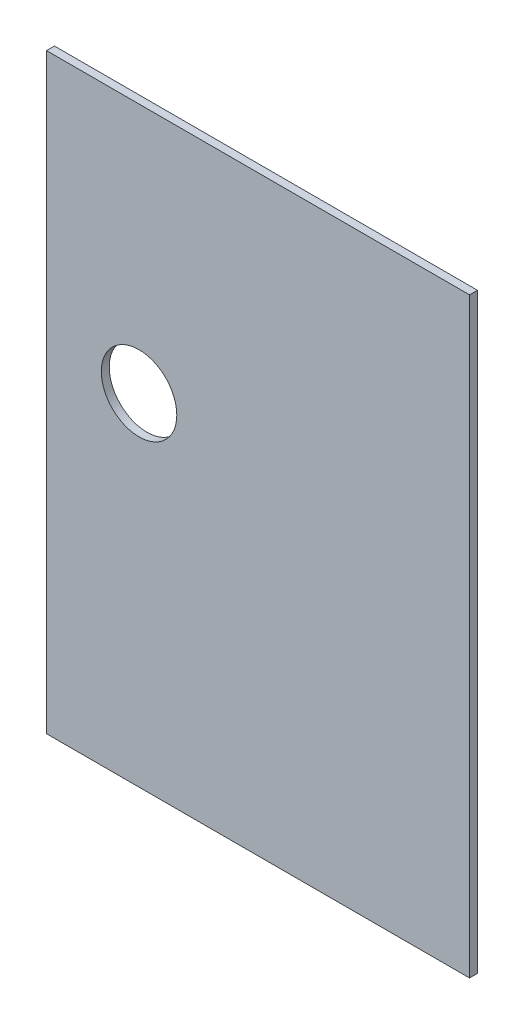
from build123d import *

# Parameters (mm, degrees)
SKETCH1_W           = 160
SKETCH1_H           = 223.74
BOSS_EXTRUDE1_DEPTH = 3
SKETCH2_R           = 14.275
CUT_EXTRUDE1_DEPTH  = 3


with BuildPart() as part:
    # Sketch1 → Boss-Extrude1 (new body)
    with BuildSketch(Plane.XY):
        with Locations((80, 111.87)):
            Rectangle(SKETCH1_W, SKETCH1_H)
    extrude(amount=BOSS_EXTRUDE1_DEPTH)

    # Sketch2 → Cut-Extrude1 (cut)
    with BuildSketch(Plane.XY.offset(3)):
        with Locations((35, 129)):
            Circle(SKETCH2_R)
    extrude(amount=-CUT_EXTRUDE1_DEPTH, mode=Mode.SUBTRACT)


solid = part.part
